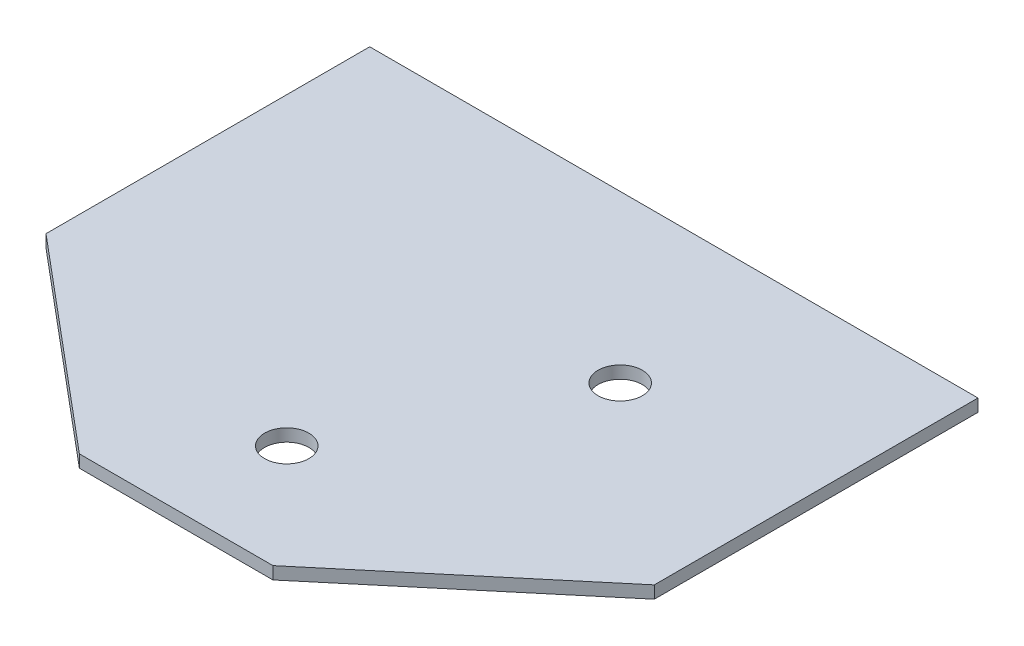
from build123d import *

# Parameters (mm, degrees)
SKETCH2_W           = 220
SKETCH2_H           = 180
BOSS_EXTRUDE1_DEPTH = 4.5
CHAMFER1_SIZE       = 75
CHAMFER1_SIZE2      = 62.932472338
SKETCH3_R           = 8
CUT_EXTRUDE1_DEPTH  = 143.197925442


with BuildPart() as part:
    # Sketch2 → Boss-Extrude1 (new body)
    with BuildSketch(Plane(origin=(0, 0, 0), x_dir=(1, 0, 0), z_dir=(0, 1, 0))):
        Rectangle(SKETCH2_W, SKETCH2_H)
    extrude(amount=BOSS_EXTRUDE1_DEPTH)

    # Chamfer1
    chamfer1_edges = [part.edges().sort_by_distance(p)[0] for p in [
        (-110, 2.25, 90),
        (110, 2.25, 90),
    ]]
    chamfer1_side = [part.faces().sort_by_distance(p)[0] for p in [
        (0, 2.25, 90),
    ]]
    chamfer(chamfer1_edges, length=CHAMFER1_SIZE, length2=CHAMFER1_SIZE2, reference=chamfer1_side[0])

    # Sketch3 → Cut-Extrude1 (cut, through all)
    with BuildSketch(Plane(origin=(0, 4.5, 0), x_dir=(1, 0, 0), z_dir=(0, 1, 0))):
        with Locations((0, -50)):
            Circle(SKETCH3_R)
        with Locations((40.6, 30)):
            Circle(SKETCH3_R)
    extrude(amount=-CUT_EXTRUDE1_DEPTH, mode=Mode.SUBTRACT)


solid = part.part
